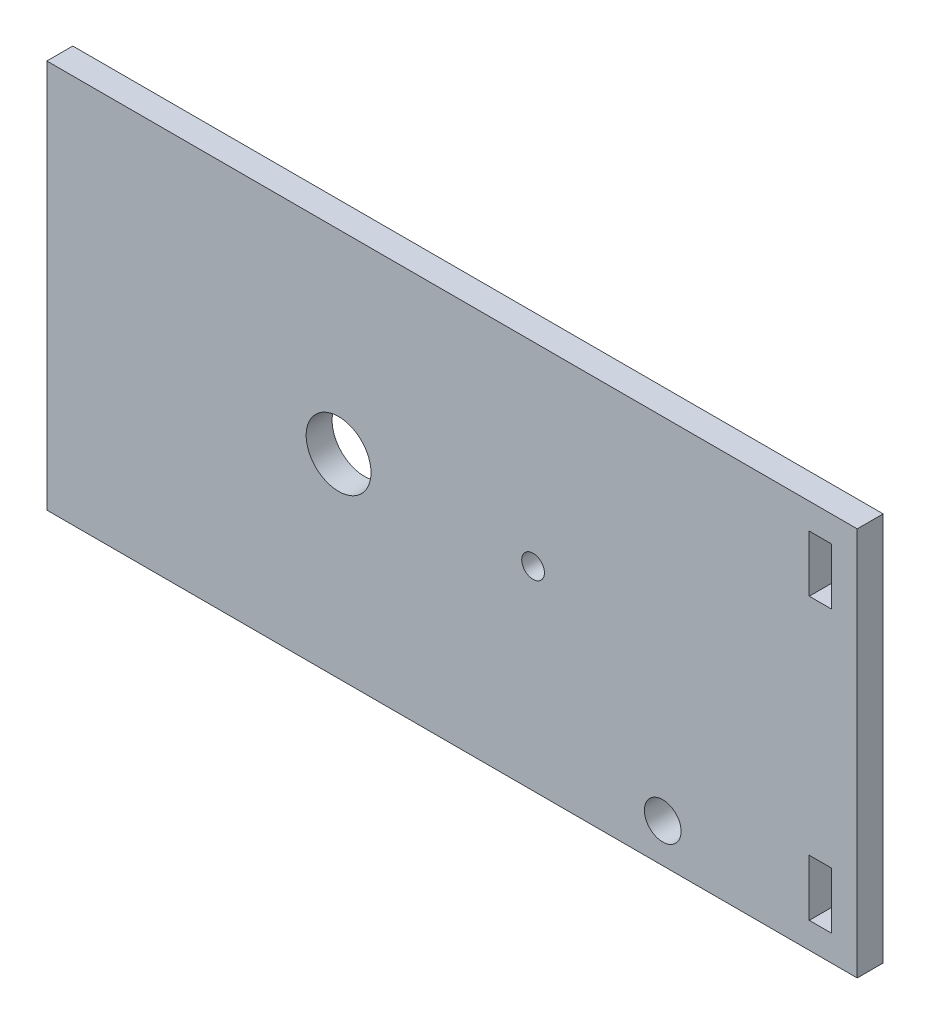
from build123d import *

# Parameters (mm, degrees)
SKETCH1_W               = 121
SKETCH1_H               = 60
SKETCH1_R               = 5
SKETCH1_R_2             = 2.83
BOSS_EXTRUDE1_DEPTH     = 4
SKETCH2_W               = 4
SKETCH2_H               = 60
BOSS_EXTRUDE2_DEPTH     = 4
CUT_EXTRUDE1_DEPTH      = 87.469647854
CUT_EXTRUDE1_DEPTH_BACK = 87.469647854
SKETCH3_R               = 1.75
SKETCH3_W               = 3.4
SKETCH3_H               = 8.7


with BuildPart() as part:
    # Sketch1 → Boss-Extrude1 (new body)
    with BuildSketch(Plane.XY):
        with Locations((-20.5, 0)):
            Rectangle(SKETCH1_W, SKETCH1_H)
        with Locations((-36, 0)):
            Circle(SKETCH1_R, mode=Mode.SUBTRACT)
        with Locations((14, -24)):
            Circle(SKETCH1_R_2, mode=Mode.SUBTRACT)
    extrude(amount=BOSS_EXTRUDE1_DEPTH)

    # Sketch2 → Boss-Extrude2 (add)
    with BuildSketch(Plane.XY):
        with Locations((42, 0)):
            Rectangle(SKETCH2_W, SKETCH2_H)
    extrude(amount=BOSS_EXTRUDE2_DEPTH)

    # Sketch3 → Cut-Extrude1 (cut, two sides: drawn at the far end of the back side and taken through both)
    with BuildSketch(Plane.XY.offset(-CUT_EXTRUDE1_DEPTH_BACK)):
        with Locations((-6, 0)):
            Circle(SKETCH3_R)
        with Locations((38.3, 21.65)):
            Rectangle(SKETCH3_W, SKETCH3_H)
        with Locations((38.3, -21.65)):
            Rectangle(SKETCH3_W, SKETCH3_H)
    extrude(amount=CUT_EXTRUDE1_DEPTH + CUT_EXTRUDE1_DEPTH_BACK, mode=Mode.SUBTRACT)


solid = part.part
